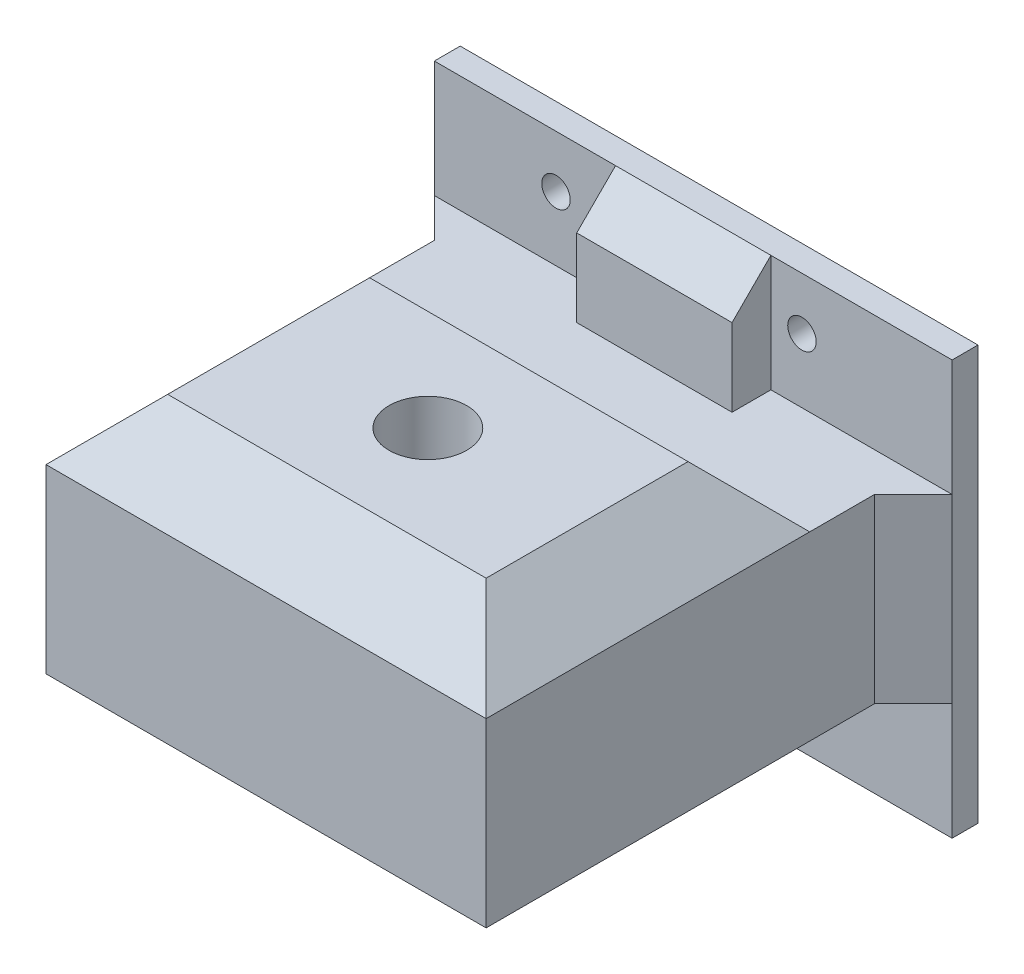
from build123d import *

# Parameters (mm, degrees)
SCHIZZO21_W                  = 200
SCHIZZO21_H                  = 160
SCHIZZO21_R                  = 5.5
ESTRUSIONE_ESTRUSIONE1_DEPTH = 10
ESTRUSIONE_ESTRUSIONE2_DEPTH = 15
SMUSSO1_SIZE                 = 15
SCHIZZO23_W                  = 170
SCHIZZO23_H                  = 70
ESTRUSIONE_ESTRUSIONE3_DEPTH = 150
SCHIZZO24_W                  = 170
SCHIZZO24_H                  = 125
ESTRUSIONE_ESTRUSIONE4_DEPTH = 23.5
SMUSSO5_SIZE                 = 23.5
SMUSSO5_OF_SPECCHIA1_SIZE    = 23.5
SCHIZZO26_R                  = 15
TAGLIO_ESTRUSIONE1_DEPTH     = 117


with BuildPart() as part:
    # Schizzo21 → Estrusione-Estrusione1 (new body)
    with BuildSketch(Plane(origin=(0, 0, 0), x_dir=(-1, 0, 0), z_dir=(0, 0, -1))):
        with Locations((-582, 267.72)):
            Rectangle(SCHIZZO21_W, SCHIZZO21_H)
        with Locations((-529, 327.5)):
            Circle(SCHIZZO21_R, mode=Mode.SUBTRACT)
        with Locations((-529, 216.5)):
            Circle(SCHIZZO21_R, mode=Mode.SUBTRACT)
        with Locations((-624, 216.5)):
            Circle(SCHIZZO21_R, mode=Mode.SUBTRACT)
        with Locations((-624, 327.5)):
            Circle(SCHIZZO21_R, mode=Mode.SUBTRACT)
    extrude(amount=ESTRUSIONE_ESTRUSIONE1_DEPTH)

    # Schizzo22 → Estrusione-Estrusione2 (add)
    with BuildSketch(Plane.XY):
        Polygon((482, 302.72), (552, 302.72), (552, 347.72), (612, 347.72), (612, 302.72), (682, 302.72), (682, 232.72), (612, 232.72), (612, 187.72), (552, 187.72), (552, 232.72), (482, 232.72), align=None)
    extrude(amount=ESTRUSIONE_ESTRUSIONE2_DEPTH)

    # Smusso1
    smusso1_edges = [part.edges().sort_by_distance(p)[0] for p in [
        (682, 267.72, 15),
        (582, 347.72, 15),
        (582, 187.72, 15),
        (482, 267.72, 15),
    ]]
    chamfer(smusso1_edges, length=SMUSSO1_SIZE)

    # Schizzo23 → Estrusione-Estrusione3 (add)
    with BuildSketch(Plane.XY.offset(15)):
        with Locations((582, 267.72)):
            Rectangle(SCHIZZO23_W, SCHIZZO23_H)
    extrude(amount=ESTRUSIONE_ESTRUSIONE3_DEPTH)

    # Schizzo24 → Estrusione-Estrusione4 (add)
    with BuildSketch(Plane(origin=(0, 302.72, 0), x_dir=(1, 0, 0), z_dir=(0, 1, 0))):
        with Locations((582, -102.5)):
            Rectangle(SCHIZZO24_W, SCHIZZO24_H)
    estrusione_estrusione4 = extrude(amount=ESTRUSIONE_ESTRUSIONE4_DEPTH)

    # Smusso5
    smusso5_edges = [part.edges().sort_by_distance(p)[0] for p in [
        (667, 326.22, 102.5),
        (582, 326.22, 40),
        (582, 326.22, 165),
        (497, 326.22, 102.5),
    ]]
    chamfer(smusso5_edges, length=SMUSSO5_SIZE - 0.0001)  # a hair under: the kernel refuses the full size

    # Specchia1: Estrusione-Estrusione4 across plane
    add(estrusione_estrusione4.mirror(Plane(origin=(0, 267.72, 0), x_dir=(0, 0, 1), z_dir=(0, -1, 0))))

    # Smusso5 of Specchia1
    smusso5_of_specchia1_edges = [part.edges().sort_by_distance(p)[0] for p in [
        (667, 209.22, 102.5),
        (582, 209.22, 40),
        (582, 209.22, 165),
        (497, 209.22, 102.5),
    ]]
    chamfer(smusso5_of_specchia1_edges, length=SMUSSO5_OF_SPECCHIA1_SIZE - 0.0001)  # a hair under: the kernel refuses the full size

    # Schizzo26 → Taglio-Estrusione1 (cut)
    with BuildSketch(Plane(origin=(0, 326.22, 0), x_dir=(1, 0, 0), z_dir=(0, 1, 0))):
        with Locations(Location((582, -102.5, 0), (0, 0, 270))):
            Circle(SCHIZZO26_R)
    extrude(amount=-TAGLIO_ESTRUSIONE1_DEPTH, mode=Mode.SUBTRACT)


solid = part.part
